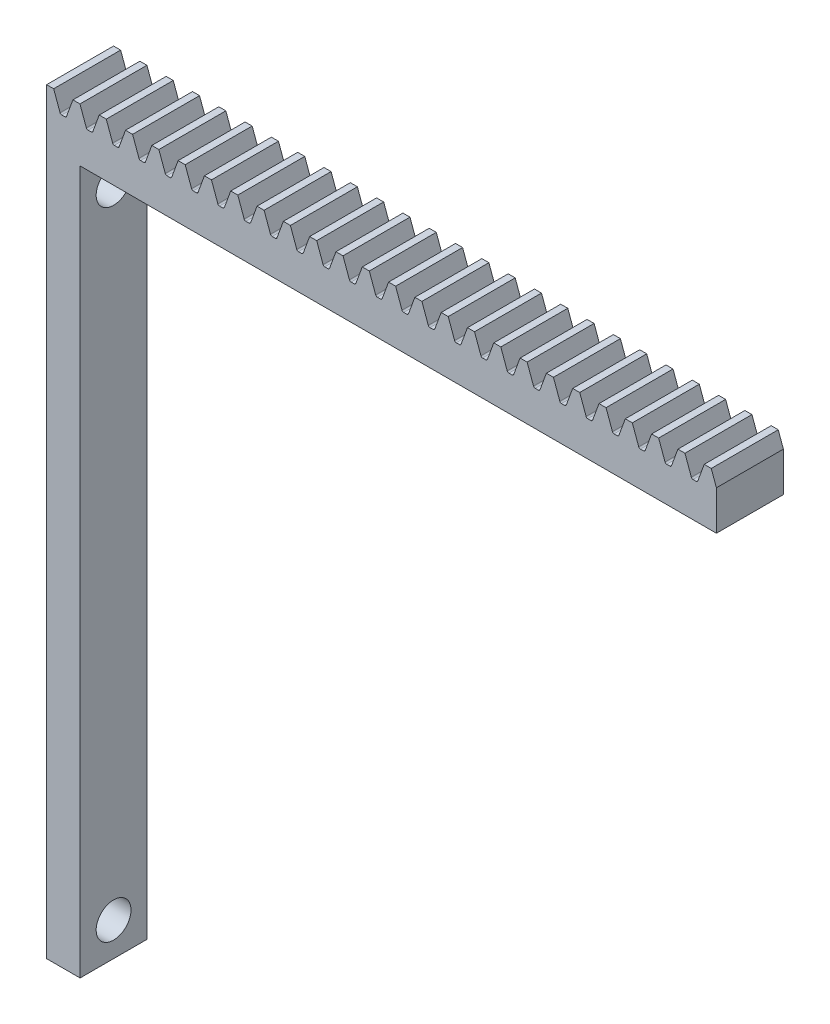
from build123d import *

# Parameters (mm, degrees)
SKETCH1_W           = 127
SKETCH1_H           = 10.16
BOSS_EXTRUDE1_DEPTH = 6.35
CUT_EXTRUDE1_DEPTH  = 12.7
FILLET3_R           = 0.320981709
LPATTERN4_START     = -6.35
LPATTERN4_DEPTH     = 12.7
SKETCH3_W           = 6.35
SKETCH3_H           = 12.7
BOSS_EXTRUDE2_DEPTH = 133.35
SKETCH4_R           = 3.302
CUT_EXTRUDE2_DEPTH  = 133.35


# Read off the part's stored shape, not the designer's step: LPattern4
with BuildPart() as part:
    # Sketch1 → Boss-Extrude1 (new, symmetric)
    with BuildSketch(Plane.XY):
        Rectangle(SKETCH1_W, SKETCH1_H)
    extrude(amount=BOSS_EXTRUDE1_DEPTH, both=True)

    # Sketch2 → Cut-Extrude1 (cut)
    with BuildSketch(Plane.XY.offset(6.35)):
        Polygon((-62.161960494, 5.08), (-60.872304763, 1.5367), (-59.802365731, 1.5367), (-58.51271, 5.08), align=None)
    extrude(amount=-CUT_EXTRUDE1_DEPTH, mode=Mode.SUBTRACT)

    # Fillet3
    fillet3_edges = [part.edges().sort_by_distance(p)[0] for p in [
        (-59.802365731, 1.5367, 0),
        (-60.872304763, 1.5367, 0),
    ]]
    fillet(fillet3_edges, radius=FILLET3_R)

    # LPattern4 outline → LPattern4 (cut)
    with BuildSketch(Plane.XY.offset(LPATTERN4_START)):
        with BuildLine():
            ThreePointArc((-55.961885094, 1.747899499), (-55.844368495, 1.594748886), (-55.66026095, 1.5367))
            Line((-55.66026095, 1.5367), (-55.039829544, 1.5367))
            ThreePointArc((-55.039829544, 1.5367), (-54.855721999, 1.594748886), (-54.7382054, 1.747899499))
            Line((-54.7382054, 1.747899499), (-53.52542, 5.08))
            Line((-53.52542, 5.08), (-57.174670494, 5.08))
            Line((-57.174670494, 5.08), (-55.961885094, 1.747899499))
        make_face()
        Polygon((63.5, 5.08), (62.520289506, 5.08), (63.5, 2.388267541), align=None)
        with BuildLine():
            Line((61.18225, 5.08), (57.532999506, 5.08))
            Line((57.532999506, 5.08), (58.745784906, 1.747899499))
            ThreePointArc((58.745784906, 1.747899499), (58.863301505, 1.594748886), (59.04740905, 1.5367))
            Line((59.04740905, 1.5367), (59.667840456, 1.5367))
            ThreePointArc((59.667840456, 1.5367), (59.851948001, 1.594748886), (59.9694646, 1.747899499))
            Line((59.9694646, 1.747899499), (61.18225, 5.08))
        make_face()
        with BuildLine():
            Line((56.19496, 5.08), (52.545709506, 5.08))
            Line((52.545709506, 5.08), (53.758494906, 1.747899499))
            ThreePointArc((53.758494906, 1.747899499), (53.876011505, 1.594748886), (54.06011905, 1.5367))
            Line((54.06011905, 1.5367), (54.680550456, 1.5367))
            ThreePointArc((54.680550456, 1.5367), (54.864658001, 1.594748886), (54.9821746, 1.747899499))
            Line((54.9821746, 1.747899499), (56.19496, 5.08))
        make_face()
        with BuildLine():
            Line((51.20767, 5.08), (47.558419506, 5.08))
            Line((47.558419506, 5.08), (48.771204906, 1.747899499))
            ThreePointArc((48.771204906, 1.747899499), (48.888721505, 1.594748886), (49.07282905, 1.5367))
            Line((49.07282905, 1.5367), (49.693260456, 1.5367))
            ThreePointArc((49.693260456, 1.5367), (49.877368001, 1.594748886), (49.9948846, 1.747899499))
            Line((49.9948846, 1.747899499), (51.20767, 5.08))
        make_face()
        with BuildLine():
            Line((46.22038, 5.08), (42.571129506, 5.08))
            Line((42.571129506, 5.08), (43.783914906, 1.747899499))
            ThreePointArc((43.783914906, 1.747899499), (43.901431505, 1.594748886), (44.08553905, 1.5367))
            Line((44.08553905, 1.5367), (44.705970456, 1.5367))
            ThreePointArc((44.705970456, 1.5367), (44.890078001, 1.594748886), (45.0075946, 1.747899499))
            Line((45.0075946, 1.747899499), (46.22038, 5.08))
        make_face()
        with BuildLine():
            Line((41.23309, 5.08), (37.583839506, 5.08))
            Line((37.583839506, 5.08), (38.796624906, 1.747899499))
            ThreePointArc((38.796624906, 1.747899499), (38.914141505, 1.594748886), (39.09824905, 1.5367))
            Line((39.09824905, 1.5367), (39.718680456, 1.5367))
            ThreePointArc((39.718680456, 1.5367), (39.902788001, 1.594748886), (40.0203046, 1.747899499))
            Line((40.0203046, 1.747899499), (41.23309, 5.08))
        make_face()
        with BuildLine():
            Line((36.2458, 5.08), (32.596549506, 5.08))
            Line((32.596549506, 5.08), (33.809334906, 1.747899499))
            ThreePointArc((33.809334906, 1.747899499), (33.926851505, 1.594748886), (34.11095905, 1.5367))
            Line((34.11095905, 1.5367), (34.731390456, 1.5367))
            ThreePointArc((34.731390456, 1.5367), (34.915498001, 1.594748886), (35.0330146, 1.747899499))
            Line((35.0330146, 1.747899499), (36.2458, 5.08))
        make_face()
        with BuildLine():
            Line((31.25851, 5.08), (27.609259506, 5.08))
            Line((27.609259506, 5.08), (28.822044906, 1.747899499))
            ThreePointArc((28.822044906, 1.747899499), (28.939561505, 1.594748886), (29.12366905, 1.5367))
            Line((29.12366905, 1.5367), (29.744100456, 1.5367))
            ThreePointArc((29.744100456, 1.5367), (29.928208001, 1.594748886), (30.0457246, 1.747899499))
            Line((30.0457246, 1.747899499), (31.25851, 5.08))
        make_face()
        with BuildLine():
            Line((26.27122, 5.08), (22.621969506, 5.08))
            Line((22.621969506, 5.08), (23.834754906, 1.747899499))
            ThreePointArc((23.834754906, 1.747899499), (23.952271505, 1.594748886), (24.13637905, 1.5367))
            Line((24.13637905, 1.5367), (24.756810456, 1.5367))
            ThreePointArc((24.756810456, 1.5367), (24.940918001, 1.594748886), (25.0584346, 1.747899499))
            Line((25.0584346, 1.747899499), (26.27122, 5.08))
        make_face()
        with BuildLine():
            Line((21.28393, 5.08), (17.634679506, 5.08))
            Line((17.634679506, 5.08), (18.847464906, 1.747899499))
            ThreePointArc((18.847464906, 1.747899499), (18.964981505, 1.594748886), (19.14908905, 1.5367))
            Line((19.14908905, 1.5367), (19.769520456, 1.5367))
            ThreePointArc((19.769520456, 1.5367), (19.953628001, 1.594748886), (20.0711446, 1.747899499))
            Line((20.0711446, 1.747899499), (21.28393, 5.08))
        make_face()
        with BuildLine():
            Line((16.29664, 5.08), (12.647389506, 5.08))
            Line((12.647389506, 5.08), (13.860174906, 1.747899499))
            ThreePointArc((13.860174906, 1.747899499), (13.977691505, 1.594748886), (14.16179905, 1.5367))
            Line((14.16179905, 1.5367), (14.782230456, 1.5367))
            ThreePointArc((14.782230456, 1.5367), (14.966338001, 1.594748886), (15.0838546, 1.747899499))
            Line((15.0838546, 1.747899499), (16.29664, 5.08))
        make_face()
        with BuildLine():
            Line((11.30935, 5.08), (7.660099506, 5.08))
            Line((7.660099506, 5.08), (8.872884906, 1.747899499))
            ThreePointArc((8.872884906, 1.747899499), (8.990401505, 1.594748886), (9.17450905, 1.5367))
            Line((9.17450905, 1.5367), (9.794940456, 1.5367))
            ThreePointArc((9.794940456, 1.5367), (9.979048001, 1.594748886), (10.0965646, 1.747899499))
            Line((10.0965646, 1.747899499), (11.30935, 5.08))
        make_face()
        with BuildLine():
            Line((6.32206, 5.08), (2.672809506, 5.08))
            Line((2.672809506, 5.08), (3.885594906, 1.747899499))
            ThreePointArc((3.885594906, 1.747899499), (4.003111505, 1.594748886), (4.18721905, 1.5367))
            Line((4.18721905, 1.5367), (4.807650456, 1.5367))
            ThreePointArc((4.807650456, 1.5367), (4.991758001, 1.594748886), (5.1092746, 1.747899499))
            Line((5.1092746, 1.747899499), (6.32206, 5.08))
        make_face()
        with BuildLine():
            Line((1.33477, 5.08), (-2.314480494, 5.08))
            Line((-2.314480494, 5.08), (-1.101695094, 1.747899499))
            ThreePointArc((-1.101695094, 1.747899499), (-0.984178495, 1.594748886), (-0.80007095, 1.5367))
            Line((-0.80007095, 1.5367), (-0.179639544, 1.5367))
            ThreePointArc((-0.179639544, 1.5367), (0.004468001, 1.594748886), (0.1219846, 1.747899499))
            Line((0.1219846, 1.747899499), (1.33477, 5.08))
        make_face()
        with BuildLine():
            Line((-3.65252, 5.08), (-7.301770494, 5.08))
            Line((-7.301770494, 5.08), (-6.088985094, 1.747899499))
            ThreePointArc((-6.088985094, 1.747899499), (-5.971468495, 1.594748886), (-5.78736095, 1.5367))
            Line((-5.78736095, 1.5367), (-5.166929544, 1.5367))
            ThreePointArc((-5.166929544, 1.5367), (-4.982821999, 1.594748886), (-4.8653054, 1.747899499))
            Line((-4.8653054, 1.747899499), (-3.65252, 5.08))
        make_face()
        with BuildLine():
            Line((-8.63981, 5.08), (-12.289060494, 5.08))
            Line((-12.289060494, 5.08), (-11.076275094, 1.747899499))
            ThreePointArc((-11.076275094, 1.747899499), (-10.958758495, 1.594748886), (-10.77465095, 1.5367))
            Line((-10.77465095, 1.5367), (-10.154219544, 1.5367))
            ThreePointArc((-10.154219544, 1.5367), (-9.970111999, 1.594748886), (-9.8525954, 1.747899499))
            Line((-9.8525954, 1.747899499), (-8.63981, 5.08))
        make_face()
        with BuildLine():
            Line((-13.6271, 5.08), (-17.276350494, 5.08))
            Line((-17.276350494, 5.08), (-16.063565094, 1.747899499))
            ThreePointArc((-16.063565094, 1.747899499), (-15.946048495, 1.594748886), (-15.76194095, 1.5367))
            Line((-15.76194095, 1.5367), (-15.141509544, 1.5367))
            ThreePointArc((-15.141509544, 1.5367), (-14.957401999, 1.594748886), (-14.8398854, 1.747899499))
            Line((-14.8398854, 1.747899499), (-13.6271, 5.08))
        make_face()
        with BuildLine():
            Line((-18.61439, 5.08), (-22.263640494, 5.08))
            Line((-22.263640494, 5.08), (-21.050855094, 1.747899499))
            ThreePointArc((-21.050855094, 1.747899499), (-20.933338495, 1.594748886), (-20.74923095, 1.5367))
            Line((-20.74923095, 1.5367), (-20.128799544, 1.5367))
            ThreePointArc((-20.128799544, 1.5367), (-19.944691999, 1.594748886), (-19.8271754, 1.747899499))
            Line((-19.8271754, 1.747899499), (-18.61439, 5.08))
        make_face()
        with BuildLine():
            Line((-23.60168, 5.08), (-27.250930494, 5.08))
            Line((-27.250930494, 5.08), (-26.038145094, 1.747899499))
            ThreePointArc((-26.038145094, 1.747899499), (-25.920628495, 1.594748886), (-25.73652095, 1.5367))
            Line((-25.73652095, 1.5367), (-25.116089544, 1.5367))
            ThreePointArc((-25.116089544, 1.5367), (-24.931981999, 1.594748886), (-24.8144654, 1.747899499))
            Line((-24.8144654, 1.747899499), (-23.60168, 5.08))
        make_face()
        with BuildLine():
            Line((-28.58897, 5.08), (-32.238220494, 5.08))
            Line((-32.238220494, 5.08), (-31.025435094, 1.747899499))
            ThreePointArc((-31.025435094, 1.747899499), (-30.907918495, 1.594748886), (-30.72381095, 1.5367))
            Line((-30.72381095, 1.5367), (-30.103379544, 1.5367))
            ThreePointArc((-30.103379544, 1.5367), (-29.919271999, 1.594748886), (-29.8017554, 1.747899499))
            Line((-29.8017554, 1.747899499), (-28.58897, 5.08))
        make_face()
        with BuildLine():
            Line((-33.57626, 5.08), (-37.225510494, 5.08))
            Line((-37.225510494, 5.08), (-36.012725094, 1.747899499))
            ThreePointArc((-36.012725094, 1.747899499), (-35.895208495, 1.594748886), (-35.71110095, 1.5367))
            Line((-35.71110095, 1.5367), (-35.090669544, 1.5367))
            ThreePointArc((-35.090669544, 1.5367), (-34.906561999, 1.594748886), (-34.7890454, 1.747899499))
            Line((-34.7890454, 1.747899499), (-33.57626, 5.08))
        make_face()
        with BuildLine():
            Line((-38.56355, 5.08), (-42.212800494, 5.08))
            Line((-42.212800494, 5.08), (-41.000015094, 1.747899499))
            ThreePointArc((-41.000015094, 1.747899499), (-40.882498495, 1.594748886), (-40.69839095, 1.5367))
            Line((-40.69839095, 1.5367), (-40.077959544, 1.5367))
            ThreePointArc((-40.077959544, 1.5367), (-39.893851999, 1.594748886), (-39.7763354, 1.747899499))
            Line((-39.7763354, 1.747899499), (-38.56355, 5.08))
        make_face()
        with BuildLine():
            Line((-43.55084, 5.08), (-47.200090494, 5.08))
            Line((-47.200090494, 5.08), (-45.987305094, 1.747899499))
            ThreePointArc((-45.987305094, 1.747899499), (-45.869788495, 1.594748886), (-45.68568095, 1.5367))
            Line((-45.68568095, 1.5367), (-45.065249544, 1.5367))
            ThreePointArc((-45.065249544, 1.5367), (-44.881141999, 1.594748886), (-44.7636254, 1.747899499))
            Line((-44.7636254, 1.747899499), (-43.55084, 5.08))
        make_face()
        with BuildLine():
            Line((-48.53813, 5.08), (-52.187380494, 5.08))
            Line((-52.187380494, 5.08), (-50.974595094, 1.747899499))
            ThreePointArc((-50.974595094, 1.747899499), (-50.857078495, 1.594748886), (-50.67297095, 1.5367))
            Line((-50.67297095, 1.5367), (-50.052539544, 1.5367))
            ThreePointArc((-50.052539544, 1.5367), (-49.868431999, 1.594748886), (-49.7509154, 1.747899499))
            Line((-49.7509154, 1.747899499), (-48.53813, 5.08))
        make_face()
    extrude(amount=LPATTERN4_DEPTH, mode=Mode.SUBTRACT)

    # Sketch3 → Boss-Extrude2 (add)
    with BuildSketch(Plane.XZ.offset(5.08)):
        with Locations((-60.325, 0)):
            Rectangle(SKETCH3_W, SKETCH3_H)
    extrude(amount=BOSS_EXTRUDE2_DEPTH)

    # Sketch4 → Cut-Extrude2 (cut)
    with BuildSketch(Plane(origin=(-57.15, 0, 0), x_dir=(0, 0, -1), z_dir=(1, 0, 0))):
        with Locations(Location((0, -11.43, 0), (0, 0, 90))):
            Circle(SKETCH4_R)
        with Locations(Location((0, -132.08, 0), (0, 0, 90))):
            Circle(SKETCH4_R)
    extrude(amount=-CUT_EXTRUDE2_DEPTH, mode=Mode.SUBTRACT)


solid = part.part
